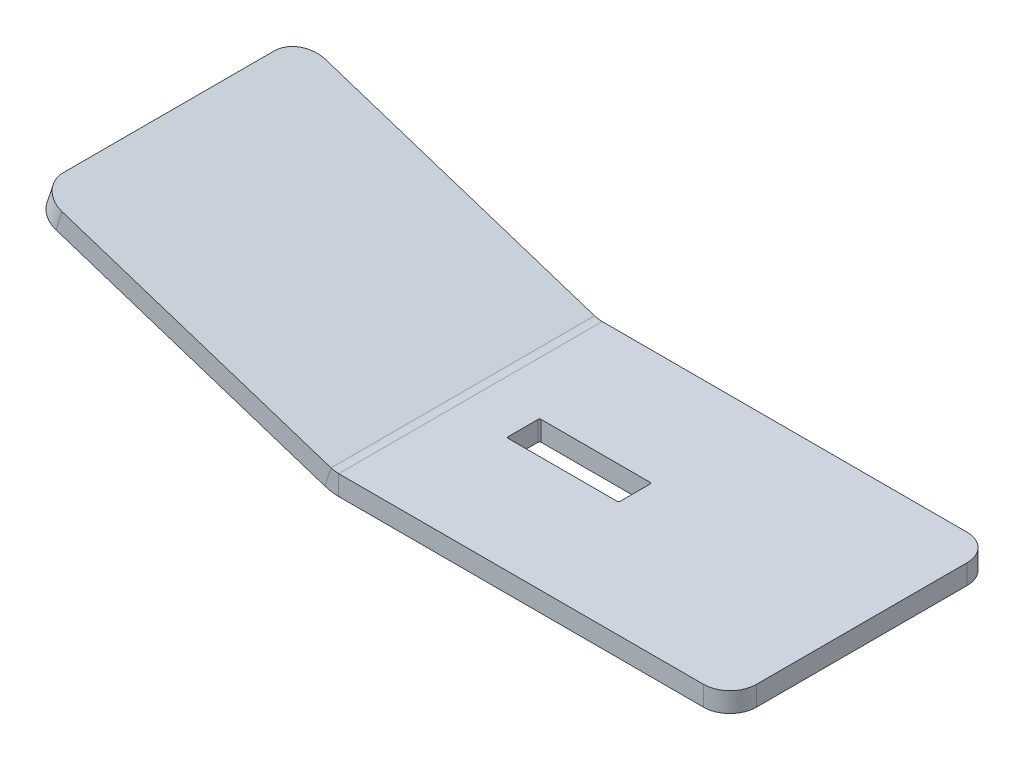
from build123d import *

# Parameters (mm, degrees)
SKETCH2_W                    = 95.25
SKETCH2_H                    = 63.5
BASE_FLANGE1_DEPTH           = 4.7752
EDGE_FLANGE1_STRIP_CUT_DEPTH = 63.5
EDGE_FLANGE1_DEPTH           = 63.5
FILLET1_R                    = 6.35
SKETCH10_W                   = 26.9875
SKETCH10_H                   = 7.9375
CUT_EXTRUDE1_DEPTH           = 117.826050987
FILLET2_R                    = 0.396875


# Sheet-metal steps are written as plain solids
with BuildPart() as part:
    # Sketch2 → Base-Flange1 (new body)
    with BuildSketch(Plane(origin=(0, 0, 0), x_dir=(1, 0, 0), z_dir=(0, 1, 0))):
        with Locations((47.625, 31.75)):
            Rectangle(SKETCH2_W, SKETCH2_H)
    extrude(amount=-BASE_FLANGE1_DEPTH)

    # Edge-Flange1 strip (across the edge) → Edge-Flange1 strip cut (cut)
    with BuildSketch(Plane(origin=(0, 0, -63.5), x_dir=(0.3090169943749416, 0.9510565162951554, 0), z_dir=(0, 0, 1))):
        Polygon((-13.826403209, 27.100421727), (-4.250584587, -2.3709176), (0.29090049, -0.895299648), (-9.284918132, 28.576039679), align=None)
    extrude(amount=EDGE_FLANGE1_STRIP_CUT_DEPTH, mode=Mode.SUBTRACT)

    # Edge-Flange1 section (across the edge) → Edge-Flange1 (add)
    with BuildSketch(Plane(origin=(0, 0, -63.5), x_dir=(0.3090169943749416, 0.9510565162951554, 0), z_dir=(0, 0, 1))):
        with BuildLine():
            Line((-4.7752, 0.94137376), (-4.7752, 75.443682621))
            Line((-4.7752, 75.443682621), (0, 75.443682621))
            Line((0, 75.443682621), (0, 0.94137376))
            ThreePointArc((0, 0.94137376), (0.073175579, 0.011589873), (0.29090049, -0.895299648))
            Line((0.29090049, -0.895299648), (-4.250584587, -2.3709176))
            ThreePointArc((-4.250584587, -2.3709176), (-4.643233785, -0.735415984), (-4.7752, 0.94137376))
        make_face()
    extrude(amount=EDGE_FLANGE1_DEPTH)

    # Fillet1
    fillet1_edges = [part.edges().sort_by_distance(p)[0] for p in [
        (-72.489014945, 21.04263751, -63.5),
        (-72.489014945, 21.04263751, 0),
        (95.25, -2.3876, -63.5),
        (95.25, -2.3876, 0),
    ]]
    fillet(fillet1_edges, radius=FILLET1_R)

    # Sketch10 → Cut-Extrude1 (cut, through all)
    with BuildSketch(Plane(origin=(0, 0, 0), x_dir=(1, 0, 0), z_dir=(0, 1, 0))):
        with Locations((27.13512376, 31.75)):
            Rectangle(SKETCH10_W, SKETCH10_H)
    extrude(amount=-CUT_EXTRUDE1_DEPTH, mode=Mode.SUBTRACT)

    # Fillet2
    fillet2_edges = [part.edges().sort_by_distance(p)[0] for p in [
        (13.64137376, -2.3876, -27.78125),
        (13.64137376, -2.3876, -35.71875),
        (40.62887376, -2.3876, -35.71875),
        (40.62887376, -2.3876, -27.78125),
    ]]
    fillet(fillet2_edges, radius=FILLET2_R)


solid = part.part
